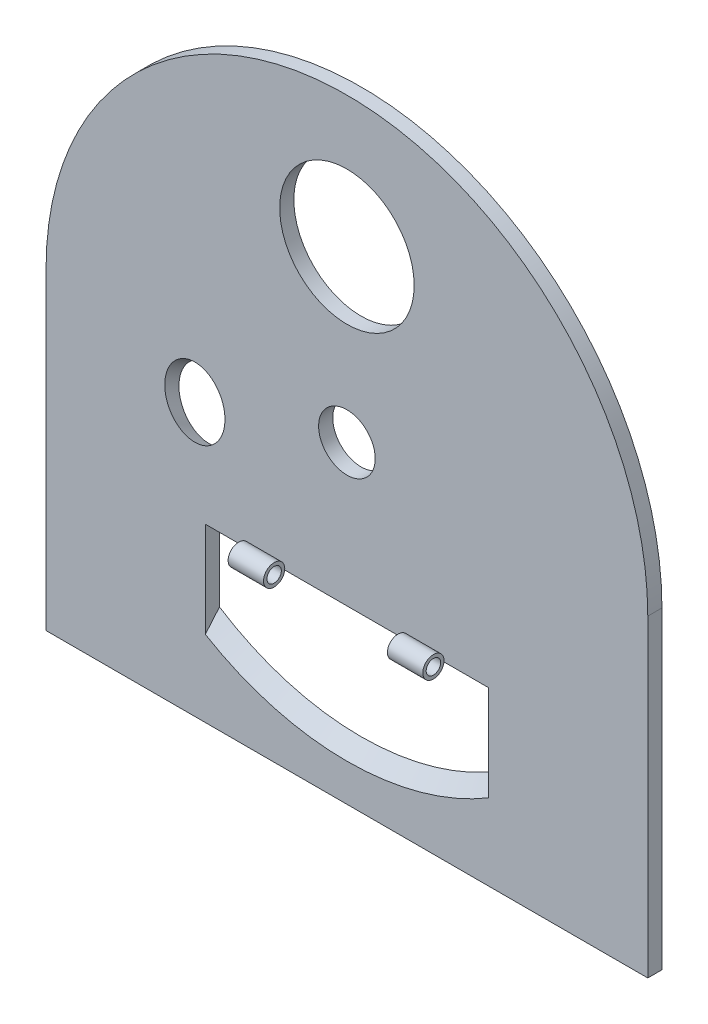
from build123d import *

# Parameters (mm, degrees)
SKETCH1_R               = 16
SKETCH1_R_2             = 38
SKETCH1_R_3             = 10
BOSS_EXTRUDE1_DEPTH     = 8
CHAMFER1_SIZE           = 8
CUT_EXTRUDE1_DEPTH      = 245.081359787
CUT_EXTRUDE1_DEPTH_BACK = 245.081359787
SKETCH3_R               = 17
SKETCH4_R               = 6
SKETCH4_R_2             = 4.079964081
BOSS_EXTRUDE2_DEPTH     = 20


with BuildPart() as part:
    # Sketch1 → Boss-Extrude1 (new body)
    with BuildSketch(Plane.XY):
        with BuildLine():
            Line((170, 0), (170, -177.077141788))
            Line((170, -177.077141788), (-170, -177.077141788))
            Line((-170, -177.077141788), (-170, 0))
            ThreePointArc((-170, 0), (0, 170), (170, 0))
        make_face()
        Circle(SKETCH1_R, mode=Mode.SUBTRACT)
        with Locations((0, 95.800068301)):
            Circle(SKETCH1_R_2, mode=Mode.SUBTRACT)
        with Locations((-85.918714518, -23.250640016)):
            Circle(SKETCH1_R_3, mode=Mode.SUBTRACT)
        with BuildLine():
            Line((-80, -80), (-80, -124.51505933))
            ThreePointArc((-80, -124.51505933), (0, -148), (80, -124.51505933))
            Line((80, -124.51505933), (80, -80))
            Line((80, -80), (-80, -80))
        make_face(mode=Mode.SUBTRACT)
    extrude(amount=BOSS_EXTRUDE1_DEPTH)

    # Chamfer1
    chamfer1_edges = [part.edges().sort_by_distance(p)[0] for p in [
        (0, -148, 8),
    ]]
    chamfer(chamfer1_edges, length=CHAMFER1_SIZE - 0.0001)  # a hair under: the kernel refuses the full size

    # Sketch3 → Cut-Extrude1 (cut, two sides: drawn at the far end of the back side and taken through both)
    with BuildSketch(Plane(origin=(0, -2.348558389, -4.067822454), x_dir=(-1, 0, 0), z_dir=(0, 0.500000000000001, 0.866025403784438)).offset(-CUT_EXTRUDE1_DEPTH_BACK)):
        with Locations(Location((85.918714518, 24.135644908, 0), (0, 0, 270))):
            Circle(SKETCH3_R)
    extrude(amount=CUT_EXTRUDE1_DEPTH + CUT_EXTRUDE1_DEPTH_BACK, mode=Mode.SUBTRACT)


with BuildPart() as body_2:
    # Sketch4 → Boss-Extrude2 (new body)
    with BuildSketch(Plane.ZY.offset(-55)):
        with Locations(Location((14.122386973, -79.217930226, 0), (0, 0, 270))):
            Circle(SKETCH4_R)
        with Locations(Location((14.122386973, -79.217930226, 0), (0, 0, 270))):
            Circle(SKETCH4_R_2, mode=Mode.SUBTRACT)
    extrude(amount=BOSS_EXTRUDE2_DEPTH)


with BuildPart() as body_3:
    # Mirror2: mirrored copy
    add(body_2.part.mirror(Plane(origin=(0, 0, 0), x_dir=(0, 0, 1), z_dir=(1, 0, 0))))


solid = Compound([part.part, body_2.part, body_3.part])
